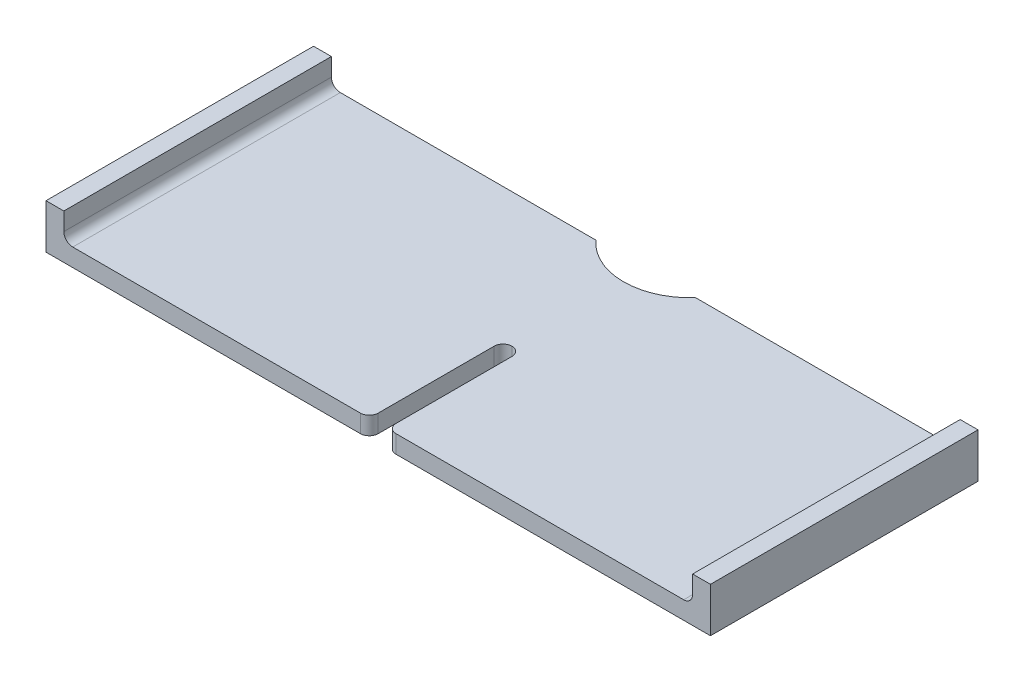
from build123d import *

# Parameters (mm, degrees)
SKETCH1_W               = 74.5
SKETCH1_H               = 30
BOSS_EXTRUDE1_DEPTH     = 2
SKETCH4_W               = 2
SKETCH4_H               = 30
BOSS_EXTRUDE2_DEPTH     = 5
CUT_EXTRUDE1_DEPTH      = 41.268629229
CUT_EXTRUDE1_DEPTH_BACK = 41.268629229
SKETCH5_W               = 2
SKETCH5_H               = 15
CUT_EXTRUDE2_DEPTH      = 41.268629229
CUT_EXTRUDE2_DEPTH_BACK = 41.268629229
SKETCH6_R               = 7.5
FILLET1_R               = 1


with BuildPart() as part:
    # Sketch1 → Boss-Extrude1 (new body)
    with BuildSketch(Plane(origin=(0, 0, 0), x_dir=(1, 0, 0), z_dir=(0, 1, 0))):
        Rectangle(SKETCH1_W, SKETCH1_H)
    extrude(amount=BOSS_EXTRUDE1_DEPTH)

    # Sketch4 → Boss-Extrude2 (add)
    with BuildSketch(Plane(origin=(0, 0, 0), x_dir=(1, 0, 0), z_dir=(0, 1, 0))):
        with Locations((36.25, 0)):
            Rectangle(SKETCH4_W, SKETCH4_H)
        with Locations((-36.25, 0)):
            Rectangle(SKETCH4_W, SKETCH4_H)
    extrude(amount=BOSS_EXTRUDE2_DEPTH)

    # Sketch5 → Cut-Extrude1 (cut, two sides: drawn at the far end of the back side and taken through both)
    with BuildSketch(Plane(origin=(0, 2, 0), x_dir=(1, 0, 0), z_dir=(0, 1, 0)).offset(-CUT_EXTRUDE1_DEPTH_BACK)):
        with Locations((0, -7.5)):
            Rectangle(SKETCH5_W, SKETCH5_H)
    extrude(amount=CUT_EXTRUDE1_DEPTH + CUT_EXTRUDE1_DEPTH_BACK, mode=Mode.SUBTRACT)

    # Sketch6 → Cut-Extrude2 (cut, two sides: drawn at the far end of the back side and taken through both)
    with BuildSketch(Plane(origin=(0, 2, 0), x_dir=(1, 0, 0), z_dir=(0, 1, 0)).offset(-CUT_EXTRUDE2_DEPTH_BACK)):
        with Locations((0, 20)):
            Circle(SKETCH6_R)
    extrude(amount=CUT_EXTRUDE2_DEPTH + CUT_EXTRUDE2_DEPTH_BACK, mode=Mode.SUBTRACT)

    # Fillet1
    fillet1_edges = [part.edges().sort_by_distance(p)[0] for p in [
        (1, 1, 15),
        (-1, 1, 15),
        (-1, 1, 0),
        (1, 1, 0),
        (-35.25, 2, 0),
        (35.25, 2, 0),
    ]]
    fillet(fillet1_edges, radius=FILLET1_R - 0.0001)  # a hair under: the kernel refuses the full size


solid = part.part
